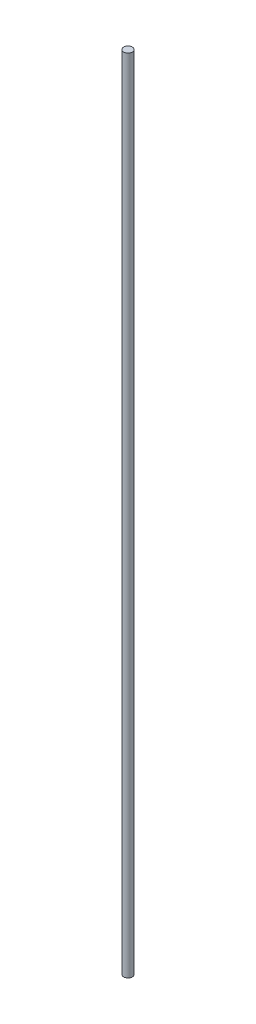
from build123d import *

# Parameters (mm, degrees)
SKETCH1_R           = 5.08
BOSS_EXTRUDE1_DEPTH = 934.72


with BuildPart() as part:
    # Sketch1 → Boss-Extrude1 (new body)
    with BuildSketch(Plane(origin=(0, 0, 0), x_dir=(1, 0, 0), z_dir=(0, 1, 0))):
        Circle(SKETCH1_R)
    extrude(amount=BOSS_EXTRUDE1_DEPTH)


solid = part.part
